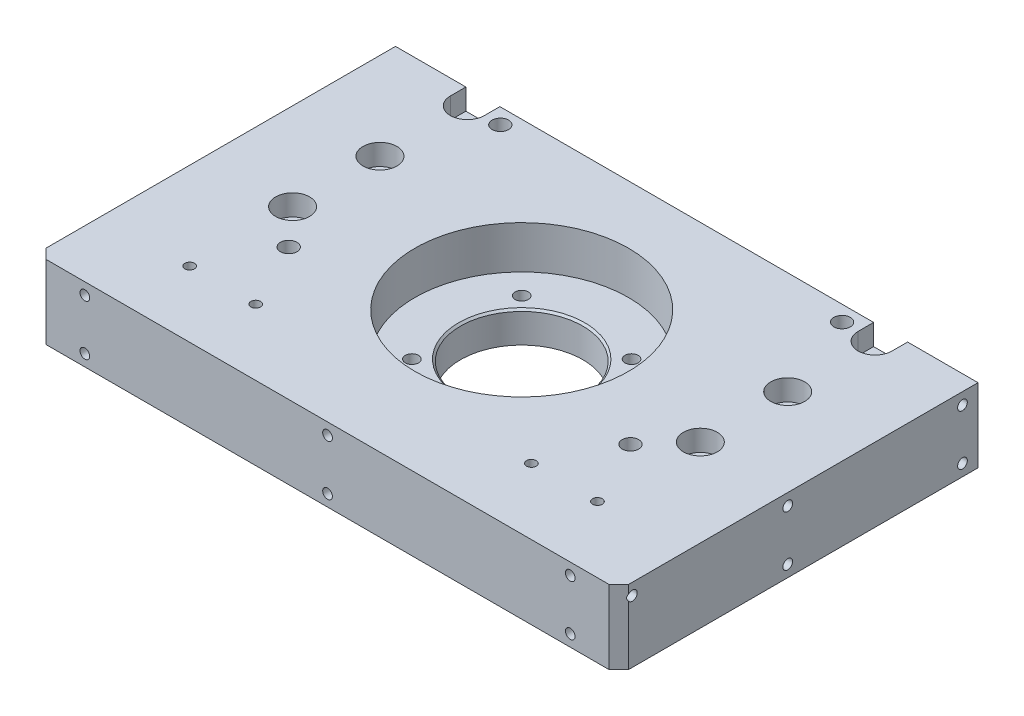
from build123d import *

# Parameters (mm, degrees)
SKETCH1_W                                        = 300
SKETCH1_H                                        = 185
BOSS_EXTRUDE1_DEPTH                              = 38
CUT_EXTRUDE1_REACH                               = 243.183
SKETCH2_R                                        = 31.5
SKETCH3_R                                        = 55
CUT_EXTRUDE2_DEPTH                               = 22
CUT_EXTRUDE3_DEPTH                               = 10.8
CBORE_FOR_M10_SOCKET_HEAD_CAP_SCREW1_D           = 12
CBORE_FOR_M10_SOCKET_HEAD_CAP_SCREW1_CBORE_D     = 17.5
CBORE_FOR_M10_SOCKET_HEAD_CAP_SCREW1_CBORE_DEPTH = 10.8
LPATTERN1_COUNT                                  = 3
LPATTERN1_PITCH                                  = 45
M10X1_5_TAPPED_HOLE1_D                           = 8.5
M10X1_5_TAPPED_HOLE1_DEPTH                       = 24.5
M10X1_5_TAPPED_HOLE1_TIP                         = 2.553657631
M10X1_5_TAPPED_HOLE2_D                           = 8.5
M10X1_5_TAPPED_HOLE2_DEPTH                       = 24.5
M10X1_5_TAPPED_HOLE2_TIP                         = 2.553657631
M8X1_25_TAPPED_HOLE1_D                           = 6.8
M6X1_0_TAPPED_HOLE1_D                            = 5
M6X1_0_TAPPED_HOLE1_DEPTH                        = 15
M6X1_0_TAPPED_HOLE1_TIP                          = 1.502151548
M6X1_0_TAPPED_HOLE2_AT_2_COUNT                   = 2
M6X1_0_TAPPED_HOLE2_AT_2_PITCH                   = 26
M6X1_0_TAPPED_HOLE2_AT_3_COUNT                   = 2
M6X1_0_TAPPED_HOLE2_AT_3_PITCH                   = 93.680307429
M6X1_0_TAPPED_HOLE2_AT_4_COUNT                   = 2
M6X1_0_TAPPED_HOLE2_AT_4_PITCH                   = 90
M6X1_0_TAPPED_HOLE3_AT_2_COUNT                   = 2
M6X1_0_TAPPED_HOLE3_AT_2_PITCH                   = 125
M6X1_0_TAPPED_HOLE3_AT_3_COUNT                   = 2
M6X1_0_TAPPED_HOLE3_AT_3_PITCH                   = 250
LPATTERN3_COUNT                                  = 2
LPATTERN3_PITCH                                  = 26
CHAMFER1_SIZE                                    = 5
CHAMFER2_SIZE                                    = 1


with BuildPart() as part:
    # Sketch1 → Boss-Extrude1 (new body)
    with BuildSketch(Plane(origin=(0, 0, 0), x_dir=(1, 0, 0), z_dir=(0, 1, 0))):
        with Locations((0, -92.5)):
            Rectangle(SKETCH1_W, SKETCH1_H)
    extrude(amount=BOSS_EXTRUDE1_DEPTH)

    # Sketch2 → Cut-Extrude1 (cut, up to next)
    with BuildSketch(Plane(origin=(0, 38, 0), x_dir=(1, 0, 0), z_dir=(0, 1, 0)), mode=Mode.PRIVATE) as cut_extrude1_sk1:
        with Locations(Location((0, -85, 0), (0, 0, 270))):
            Circle(SKETCH2_R)
    cut_extrude1_tool1 = extrude(cut_extrude1_sk1.sketch, amount=-CUT_EXTRUDE1_REACH, mode=Mode.PRIVATE) & part.part
    add(cut_extrude1_tool1.solids().sort_by_distance((0, 38, 85))[0], mode=Mode.SUBTRACT)

    # Sketch3 → Cut-Extrude2 (cut)
    with BuildSketch(Plane(origin=(0, 38, 0), x_dir=(1, 0, 0), z_dir=(0, 1, 0))):
        with Locations(Location((0, -85, 0), (0, 0, 270))):
            Circle(SKETCH3_R)
    extrude(amount=-CUT_EXTRUDE2_DEPTH, mode=Mode.SUBTRACT)

    # Sketch6 → Cut-Extrude3 (cut)
    with BuildSketch(Plane(origin=(0, 38, 0), x_dir=(1, 0, 0), z_dir=(0, 1, 0))):
        with BuildLine():
            Line((-113.75, -8), (-113.75, 0))
            Line((-113.75, 0), (-96.25, 0))
            Line((-96.25, 0), (-96.25, -8))
            ThreePointArc((-96.25, -8), (-105, -16.75), (-113.75, -8))
        make_face()
        with BuildLine():
            Line((96.25, -8), (96.25, 0))
            Line((96.25, 0), (113.75, 0))
            Line((113.75, 0), (113.75, -8))
            ThreePointArc((113.75, -8), (105, -16.75), (96.25, -8))
        make_face()
    extrude(amount=-CUT_EXTRUDE3_DEPTH, mode=Mode.SUBTRACT)

    # CBORE for M10 Socket Head Cap Screw1 (through all)
    with Locations(Plane(origin=(0, 38, 0), x_dir=(-1, 0, 0), z_dir=(0, 1, 0))):
        with Locations((105, 8), (-105, 8)):
            cbore_for_m10_socket_head_cap_screw1 = CounterBoreHole(CBORE_FOR_M10_SOCKET_HEAD_CAP_SCREW1_D / 2, CBORE_FOR_M10_SOCKET_HEAD_CAP_SCREW1_CBORE_D / 2, CBORE_FOR_M10_SOCKET_HEAD_CAP_SCREW1_CBORE_DEPTH)

    # LPattern1: CBORE for M10 Socket Head Cap Screw1 ×3
    with Locations(*[(0, 0, i * LPATTERN1_PITCH) for i in range(1, LPATTERN1_COUNT)]):
        add(cbore_for_m10_socket_head_cap_screw1, mode=Mode.SUBTRACT)

    # M10x1.5 Tapped Hole1
    with Locations(Plane(origin=(0, 38, 0), x_dir=(-1, 0, 0), z_dir=(0, 1, 0))):
        with Locations((88, 8), (-88, 8), (-88, 117), (88, 117)):
            Hole(M10X1_5_TAPPED_HOLE1_D / 2, depth=M10X1_5_TAPPED_HOLE1_DEPTH)
            with Locations((0, 0, -(M10X1_5_TAPPED_HOLE1_DEPTH + M10X1_5_TAPPED_HOLE1_TIP / 2))):  # 118° drill point
                Cone(0, M10X1_5_TAPPED_HOLE1_D / 2, M10X1_5_TAPPED_HOLE1_TIP, mode=Mode.SUBTRACT)

    # M10x1.5 Tapped Hole2
    with Locations(Plane.XZ):
        with Locations((25, 174), (-25, 174)):
            Hole(M10X1_5_TAPPED_HOLE2_D / 2, depth=M10X1_5_TAPPED_HOLE2_DEPTH)
            with Locations((0, 0, -(M10X1_5_TAPPED_HOLE2_DEPTH + M10X1_5_TAPPED_HOLE2_TIP / 2))):  # 118° drill point
                Cone(0, M10X1_5_TAPPED_HOLE2_D / 2, M10X1_5_TAPPED_HOLE2_TIP, mode=Mode.SUBTRACT)

    # M8x1.25 Tapped Hole1 (through all)
    with Locations(Plane(origin=(0, 16, 0), x_dir=(-1, 0, 0), z_dir=(0, 1, 0))):
        with Locations((28.284271247, 113.284271247), (-28.284271247, 113.284271247), (-28.284271247, 56.715728753), (28.284271247, 56.715728753)):
            Hole(M8X1_25_TAPPED_HOLE1_D / 2)

    # M6x1.0 Tapped Hole1
    with Locations(Plane(origin=(0, 38, 0), x_dir=(-1, 0, 0), z_dir=(0, 1, 0))):
        with Locations((-71, 151), (71, 151), (-105, 151), (105, 151)):
            Hole(M6X1_0_TAPPED_HOLE1_D / 2, depth=M6X1_0_TAPPED_HOLE1_DEPTH)
            with Locations((0, 0, -(M6X1_0_TAPPED_HOLE1_DEPTH + M6X1_0_TAPPED_HOLE1_TIP / 2))):  # 118° drill point
                Cone(0, M6X1_0_TAPPED_HOLE1_D / 2, M6X1_0_TAPPED_HOLE1_TIP, mode=Mode.SUBTRACT)

    # Sketch15 → M6x1.0 Tapped Hole2 (revolve, cut)
    with BuildSketch(Plane(origin=(150, 6, 8), x_dir=(0, 0, -1), z_dir=(0, 1, 0))):
        Polygon((0, 0), (0, 16.502151548), (2.5, 15), (2.5, 0), align=None)
    m6x1_0_tapped_hole2 = revolve(axis=Axis((156.35, 6, 8), (-1, 0, 0)), mode=Mode.SUBTRACT)

    # M6x1.0 Tapped Hole2 at 2: M6x1.0 Tapped Hole2 ×2
    with Locations(*[(0, i * M6X1_0_TAPPED_HOLE2_AT_2_PITCH, 0) for i in range(1, M6X1_0_TAPPED_HOLE2_AT_2_COUNT)]):
        add(m6x1_0_tapped_hole2, mode=Mode.SUBTRACT)

    # M6x1.0 Tapped Hole2 at 3: M6x1.0 Tapped Hole2 ×2
    with Locations(*[Vector(0, 0.27753965282077453, 0.9607141828411425) * (i * M6X1_0_TAPPED_HOLE2_AT_3_PITCH) for i in range(1, M6X1_0_TAPPED_HOLE2_AT_3_COUNT)]):
        add(m6x1_0_tapped_hole2, mode=Mode.SUBTRACT)

    # M6x1.0 Tapped Hole2 at 4: M6x1.0 Tapped Hole2 ×2
    with Locations(*[(0, 0, i * M6X1_0_TAPPED_HOLE2_AT_4_PITCH) for i in range(1, M6X1_0_TAPPED_HOLE2_AT_4_COUNT)]):
        add(m6x1_0_tapped_hole2, mode=Mode.SUBTRACT)

    # Sketch17 → M6x1.0 Tapped Hole4 (revolve, cut)
    with BuildSketch(Plane(origin=(150, 32, 178), x_dir=(0, 0, -1), z_dir=(0, 1, 0))):
        Polygon((0, 0), (0, 16.502151548), (2.5, 15), (2.5, 0), align=None)
    m6x1_0_tapped_hole4 = revolve(axis=Axis((156.35, 32, 178), (-1, 0, 0)), mode=Mode.SUBTRACT)

    # Mirror1: M6x1.0 Tapped Hole2, M6x1.0 Tapped Hole4 across plane
    add(m6x1_0_tapped_hole2.mirror(Plane(origin=(0, 0, 0), x_dir=(0, 0, 1), z_dir=(1, 0, 0))), mode=Mode.SUBTRACT)
    add(m6x1_0_tapped_hole4.mirror(Plane(origin=(0, 0, 0), x_dir=(0, 0, 1), z_dir=(1, 0, 0))), mode=Mode.SUBTRACT)

    # Mirror1 copy 1 sketch → Mirror1 copy 1 (revolve, cut)
    with BuildSketch(Plane(origin=(-150, 32, 8), x_dir=(0, 0, -1), z_dir=(0, 1, 0))):
        Polygon((0, 0), (0, -16.502151548), (2.5, -15), (2.5, 0), align=None)
    revolve(axis=Axis((-156.35, 32, 8), (-1, 0, 0)), mode=Mode.SUBTRACT)

    # Mirror1 copy 2 sketch → Mirror1 copy 2 (revolve, cut)
    with BuildSketch(Plane(origin=(-150, 32, 98), x_dir=(0, 0, -1), z_dir=(0, 1, 0))):
        Polygon((0, 0), (0, -16.502151548), (2.5, -15), (2.5, 0), align=None)
    revolve(axis=Axis((-156.35, 32, 98), (-1, 0, 0)), mode=Mode.SUBTRACT)

    # Mirror1 copy 3 sketch → Mirror1 copy 3 (revolve, cut)
    with BuildSketch(Plane(origin=(-150, 6, 98), x_dir=(0, 0, -1), z_dir=(0, 1, 0))):
        Polygon((0, 0), (0, -16.502151548), (2.5, -15), (2.5, 0), align=None)
    revolve(axis=Axis((-156.35, 6, 98), (-1, 0, 0)), mode=Mode.SUBTRACT)

    # Sketch19 → M6x1.0 Tapped Hole3 (revolve, cut)
    with BuildSketch(Plane(origin=(125, 6, 185), x_dir=(0, -1, 0), z_dir=(1, 0, 0))):
        Polygon((0, 0), (0, 16.502151548), (2.5, 15), (2.5, 0), align=None)
    m6x1_0_tapped_hole3 = revolve(axis=Axis((125, 6, 191.35), (0, 0, -1)), mode=Mode.SUBTRACT)

    # M6x1.0 Tapped Hole3 at 2: M6x1.0 Tapped Hole3 ×2
    with Locations(*[(-i * M6X1_0_TAPPED_HOLE3_AT_2_PITCH, 0, 0) for i in range(1, M6X1_0_TAPPED_HOLE3_AT_2_COUNT)]):
        add(m6x1_0_tapped_hole3, mode=Mode.SUBTRACT)

    # M6x1.0 Tapped Hole3 at 3: M6x1.0 Tapped Hole3 ×2
    with Locations(*[(-i * M6X1_0_TAPPED_HOLE3_AT_3_PITCH, 0, 0) for i in range(1, M6X1_0_TAPPED_HOLE3_AT_3_COUNT)]):
        add(m6x1_0_tapped_hole3, mode=Mode.SUBTRACT)

    # LPattern3: M6x1.0 Tapped Hole3 ×2
    with Locations(*[(0, i * LPATTERN3_PITCH, 0) for i in range(1, LPATTERN3_COUNT)]):
        add(m6x1_0_tapped_hole3, mode=Mode.SUBTRACT)

    # LPattern3 copy 1 sketch → LPattern3 copy 1 (revolve, cut)
    with BuildSketch(Plane(origin=(0, 32, 185), x_dir=(0, -1, 0), z_dir=(1, 0, 0))):
        Polygon((0, 0), (0, 16.502151548), (2.5, 15), (2.5, 0), align=None)
    revolve(axis=Axis((0, 32, 191.35), (0, 0, -1)), mode=Mode.SUBTRACT)

    # LPattern3 copy 2 sketch → LPattern3 copy 2 (revolve, cut)
    with BuildSketch(Plane(origin=(-125, 32, 185), x_dir=(0, -1, 0), z_dir=(1, 0, 0))):
        Polygon((0, 0), (0, 16.502151548), (2.5, 15), (2.5, 0), align=None)
    revolve(axis=Axis((-125, 32, 191.35), (0, 0, -1)), mode=Mode.SUBTRACT)

    # Chamfer1
    # the kernel refuses this chamfer: 5 mm, written as the material it takes off along each edge
    with BuildSketch(Plane(origin=(150, -12.85841494, 185), x_dir=(0.027495876610587663, 0, -0.9996219169112968), z_dir=(0, 1, 0))) as chamfer1_piece_1:
        Polygon((CHAMFER1_SIZE * 0.999621916911, CHAMFER1_SIZE * 0.0274958766106), (-CHAMFER1_SIZE * 0.0274958766106, CHAMFER1_SIZE * 0.999621916911), (0, 0), align=None)
    extrude(amount=63.71682988, mode=Mode.SUBTRACT)
    with BuildSketch(Plane(origin=(-150, -12.85841494, 185), x_dir=(-0.027495876610587663, 0, -0.9996219169112968), z_dir=(0, 1, 0))) as chamfer1_piece_2:
        Polygon((CHAMFER1_SIZE * 0.999621916911, -CHAMFER1_SIZE * 0.0274958766106), (-CHAMFER1_SIZE * 0.0274958766106, -CHAMFER1_SIZE * 0.999621916911), (0, 0), align=None)
    extrude(amount=63.71682988, mode=Mode.SUBTRACT)

    # Chamfer2
    chamfer2_edges = [part.edges().sort_by_distance(p)[0] for p in [
        (0, 16, 53.5),
    ]]
    chamfer(chamfer2_edges, length=CHAMFER2_SIZE)


solid = part.part
